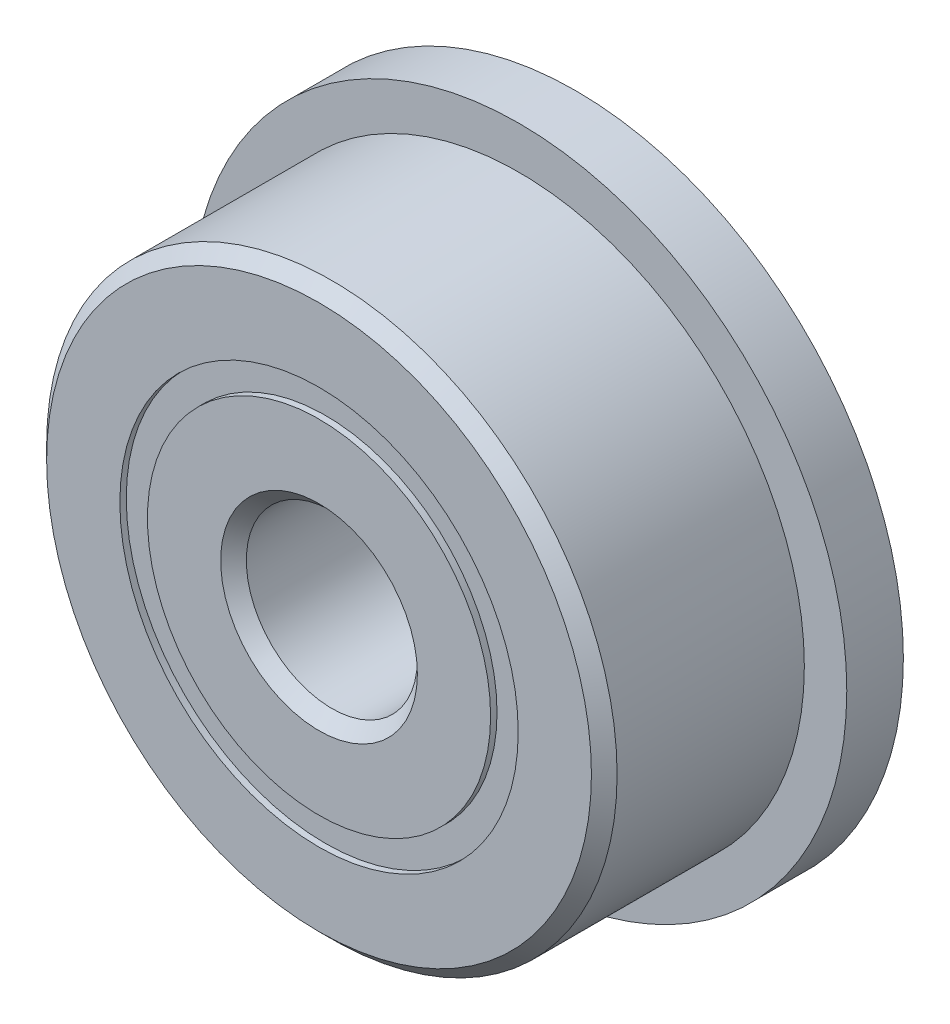
from build123d import *

# Parameters (mm, degrees)
CIRPATTERN1_COUNT = 12
SKETCH5_W         = 0.879852806
SKETCH5_H         = 0.383847032
SKETCH6_W         = 0.7874
SKETCH6_H         = 1.788006484


with BuildPart() as part:
    # Sketch1 → Revolve1 (revolve)
    with BuildSketch(Plane(origin=(0, 0, 0), x_dir=(0, 0, -1), z_dir=(1, 0, 0))):
        with BuildLine():
            Line((1.607058, 3.96875), (-1.607058, 3.96875))
            Line((-1.607058, 3.96875), (-1.78562, 3.790188))
            Line((-1.78562, 3.790188), (-1.78562, 2.771293516))
            Line((-1.78562, 2.771293516), (-0.793608889, 2.771293516))
            ThreePointArc((-0.793608889, 2.771293516), (0, 3.395856194), (0.793608889, 2.771293516))
            Line((0.793608889, 2.771293516), (1.78562, 2.771293516))
            Line((1.78562, 2.771293516), (1.78562, 3.790188))
            Line((1.78562, 3.790188), (1.607058, 3.96875))
        make_face()
    revolve(axis=Axis((0, 0, 1.78562), (0, 0, -1)))

    # Sketch6 → Revolve6 (revolve)
    with BuildSketch(Plane(origin=(0, 0, 0), x_dir=(0, 0, -1), z_dir=(1, 0, 0))):
        with Locations((1.39192, 3.665296758)):
            Rectangle(SKETCH6_W, SKETCH6_H)
    revolve(axis=Axis((0, 0, -1.78562), (0, 0, 1)))


with BuildPart() as body_2:
    # Sketch3 → Revolve3 (revolve)
    with BuildSketch(Plane(origin=(0, 0, 0), x_dir=(0, 0, -1), z_dir=(1, 0, 0))):
        with BuildLine():
            Line((-1.78562, 2.387446484), (-0.793608889, 2.387446484))
            ThreePointArc((-0.793608889, 2.387446484), (0, 1.762883806), (0.793608889, 2.387446484))
            Line((0.793608889, 2.387446484), (1.78562, 2.387446484))
            Line((1.78562, 2.387446484), (1.78562, 1.368552))
            Line((1.78562, 1.368552), (1.607058, 1.18999))
            Line((1.607058, 1.18999), (-1.607058, 1.18999))
            Line((-1.607058, 1.18999), (-1.78562, 1.368552))
            Line((-1.78562, 1.368552), (-1.78562, 2.387446484))
        make_face()
    revolve(axis=Axis((0, 0, 1.78562), (0, 0, -1)))


with BuildPart() as body_3:
    # Sketch4 → Revolve4 (revolve)
    with BuildSketch(Plane(origin=(0, 0, 0), x_dir=(0, 0, -1), z_dir=(1, 0, 0))):
        with BuildLine():
            Line((-0.816486194, 2.57937), (0.816486194, 2.57937))
            ThreePointArc((0.816486194, 2.57937), (0, 3.395856194), (-0.816486194, 2.57937))
        make_face()
    revolve(axis=Axis((0, 2.57937, 0.816486194), (0, 0, -1)))


with BuildPart() as cirpattern1_1:
    # CirPattern1: pattern copy
    add(body_3.part.rotate(Axis((0, 0, -1.78562), (0, 0, 1)), 1 * 360 / CIRPATTERN1_COUNT))


with BuildPart() as cirpattern1_2:
    # CirPattern1: pattern copy
    add(body_3.part.rotate(Axis((0, 0, -1.78562), (0, 0, 1)), 2 * 360 / CIRPATTERN1_COUNT))


with BuildPart() as cirpattern1_3:
    # CirPattern1: pattern copy
    add(body_3.part.rotate(Axis((0, 0, -1.78562), (0, 0, 1)), 3 * 360 / CIRPATTERN1_COUNT))


with BuildPart() as cirpattern1_4:
    # CirPattern1: pattern copy
    add(body_3.part.rotate(Axis((0, 0, -1.78562), (0, 0, 1)), 4 * 360 / CIRPATTERN1_COUNT))


with BuildPart() as cirpattern1_5:
    # CirPattern1: pattern copy
    add(body_3.part.rotate(Axis((0, 0, -1.78562), (0, 0, 1)), 5 * 360 / CIRPATTERN1_COUNT))


with BuildPart() as cirpattern1_6:
    # CirPattern1: pattern copy
    add(body_3.part.rotate(Axis((0, 0, -1.78562), (0, 0, 1)), 6 * 360 / CIRPATTERN1_COUNT))


with BuildPart() as cirpattern1_7:
    # CirPattern1: pattern copy
    add(body_3.part.rotate(Axis((0, 0, -1.78562), (0, 0, 1)), 7 * 360 / CIRPATTERN1_COUNT))


with BuildPart() as cirpattern1_8:
    # CirPattern1: pattern copy
    add(body_3.part.rotate(Axis((0, 0, -1.78562), (0, 0, 1)), 8 * 360 / CIRPATTERN1_COUNT))


with BuildPart() as cirpattern1_9:
    # CirPattern1: pattern copy
    add(body_3.part.rotate(Axis((0, 0, -1.78562), (0, 0, 1)), 9 * 360 / CIRPATTERN1_COUNT))


with BuildPart() as cirpattern1_10:
    # CirPattern1: pattern copy
    add(body_3.part.rotate(Axis((0, 0, -1.78562), (0, 0, 1)), 10 * 360 / CIRPATTERN1_COUNT))


with BuildPart() as cirpattern1_11:
    # CirPattern1: pattern copy
    add(body_3.part.rotate(Axis((0, 0, -1.78562), (0, 0, 1)), 11 * 360 / CIRPATTERN1_COUNT))


with BuildPart() as body_15:
    # Sketch5 → Revolve5 (revolve)
    with BuildSketch(Plane(origin=(0, 0, 0), x_dir=(0, 0, -1), z_dir=(1, 0, 0))):
        with Locations((-1.256412597, 2.57937)):
            Rectangle(SKETCH5_W, SKETCH5_H)
        with Locations((1.256412597, 2.57937)):
            Rectangle(SKETCH5_W, SKETCH5_H)
    revolve(axis=Axis((0, 0, 1.78562), (0, 0, -1)))


solid = Compound([part.part, body_2.part, body_3.part, cirpattern1_1.part, cirpattern1_2.part, cirpattern1_3.part, cirpattern1_4.part, cirpattern1_5.part, cirpattern1_6.part, cirpattern1_7.part, cirpattern1_8.part, cirpattern1_9.part, cirpattern1_10.part, cirpattern1_11.part, body_15.part])
